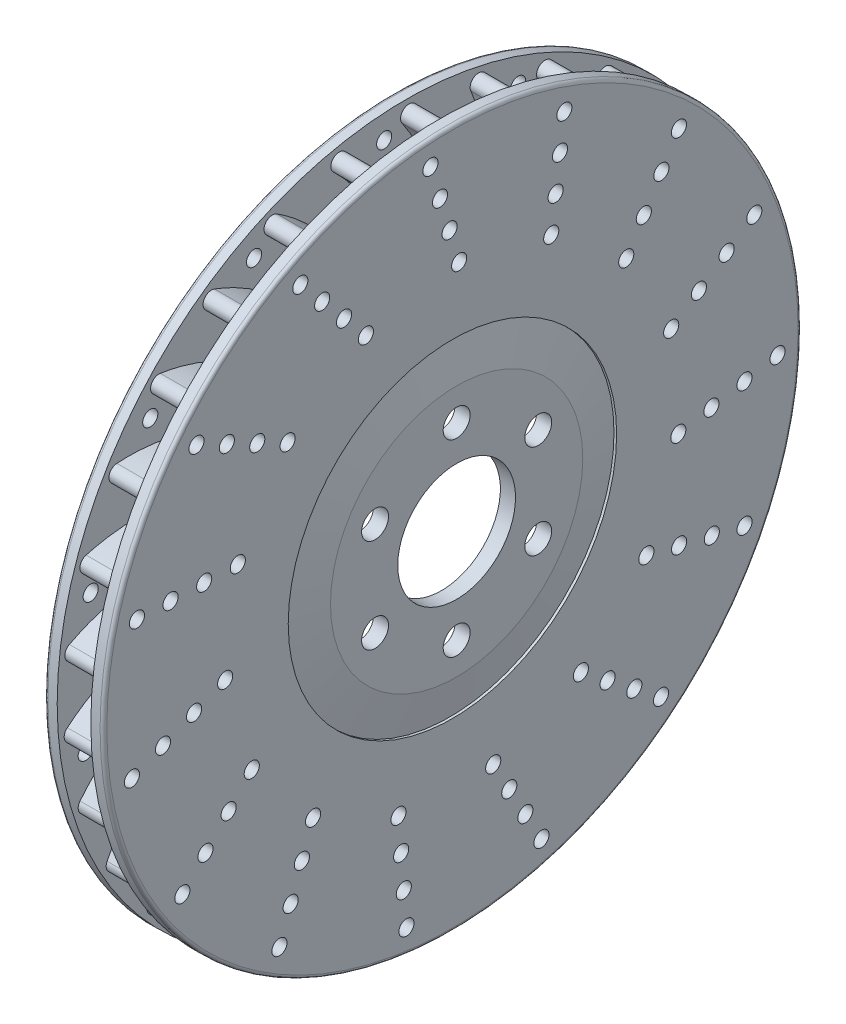
from build123d import *
from build123d.topology import SkipClean

# Parameters (mm, degrees)
SKETCH2_R                    = 8
CUT_EXTRUDE1_DEPTH           = 142.707445111
CIRPATTERN1_COUNT            = 6
SKETCH3_R                    = 207.5
SKETCH3_R_2                  = 125
BOSS_EXTRUDE1_DEPTH          = 7.5
BOSS_EXTRUDE2_DEPTH          = 20
SKETCH7_R                    = 207.5
BOSS_EXTRUDE3_DEPTH          = 7.5
CUT_EXTRUDE2_START           = -37.5
SKETCH6_R                    = 4.5
CUT_EXTRUDE2_DEPTH           = 89.5
LPATTERN1_COUNT              = 4
LPATTERN1_PITCH              = 20
CIRPATTERN5_COUNT            = 15
CIRPATTERN5_START            = -37.5
CIRPATTERN5_COPY_1_SKETCH_R  = 4.5
CIRPATTERN5_COPY_1_DEPTH     = 89.5
CIRPATTERN5_COPY_2_SKETCH_R  = 4.5
CIRPATTERN5_COPY_2_DEPTH     = 89.5
CIRPATTERN5_COPY_3_SKETCH_R  = 4.5
CIRPATTERN5_COPY_3_DEPTH     = 89.5
CIRPATTERN5_COPY_4_SKETCH_R  = 4.5
CIRPATTERN5_COPY_4_DEPTH     = 89.5
CIRPATTERN5_COPY_5_SKETCH_R  = 4.5
CIRPATTERN5_COPY_5_DEPTH     = 89.5
CIRPATTERN5_COPY_6_SKETCH_R  = 4.5
CIRPATTERN5_COPY_6_DEPTH     = 89.5
CIRPATTERN5_COPY_7_SKETCH_R  = 4.5
CIRPATTERN5_COPY_7_DEPTH     = 89.5
CIRPATTERN5_COPY_8_SKETCH_R  = 4.5
CIRPATTERN5_COPY_8_DEPTH     = 89.5
CIRPATTERN5_COPY_9_SKETCH_R  = 4.5
CIRPATTERN5_COPY_9_DEPTH     = 89.5
CIRPATTERN5_COPY_10_SKETCH_R = 4.5
CIRPATTERN5_COPY_10_DEPTH    = 89.5
CIRPATTERN5_COPY_11_SKETCH_R = 4.5
CIRPATTERN5_COPY_11_DEPTH    = 89.5
CIRPATTERN5_COPY_12_SKETCH_R = 4.5
CIRPATTERN5_COPY_12_DEPTH    = 89.5
CIRPATTERN5_COPY_13_SKETCH_R = 4.5
CIRPATTERN5_COPY_13_DEPTH    = 89.5
CIRPATTERN5_COPY_14_SKETCH_R = 4.5
CIRPATTERN5_COPY_14_DEPTH    = 89.5
CIRPATTERN5_COPY_15_SKETCH_R = 4.5
CIRPATTERN5_COPY_15_DEPTH    = 89.5
CIRPATTERN5_COPY_16_SKETCH_R = 4.5
CIRPATTERN5_COPY_16_DEPTH    = 89.5
CIRPATTERN5_COPY_17_SKETCH_R = 4.5
CIRPATTERN5_COPY_17_DEPTH    = 89.5
CIRPATTERN5_COPY_18_SKETCH_R = 4.5
CIRPATTERN5_COPY_18_DEPTH    = 89.5
CIRPATTERN5_COPY_19_SKETCH_R = 4.5
CIRPATTERN5_COPY_19_DEPTH    = 89.5
CIRPATTERN5_COPY_20_SKETCH_R = 4.5
CIRPATTERN5_COPY_20_DEPTH    = 89.5
CIRPATTERN5_COPY_21_SKETCH_R = 4.5
CIRPATTERN5_COPY_21_DEPTH    = 89.5
CIRPATTERN5_COPY_22_SKETCH_R = 4.5
CIRPATTERN5_COPY_22_DEPTH    = 89.5
CIRPATTERN5_COPY_23_SKETCH_R = 4.5
CIRPATTERN5_COPY_23_DEPTH    = 89.5
CIRPATTERN5_COPY_24_SKETCH_R = 4.5
CIRPATTERN5_COPY_24_DEPTH    = 89.5
CIRPATTERN5_COPY_25_SKETCH_R = 4.5
CIRPATTERN5_COPY_25_DEPTH    = 89.5
CIRPATTERN5_COPY_26_SKETCH_R = 4.5
CIRPATTERN5_COPY_26_DEPTH    = 89.5
CIRPATTERN5_COPY_27_SKETCH_R = 4.5
CIRPATTERN5_COPY_27_DEPTH    = 89.5
CIRPATTERN5_COPY_28_SKETCH_R = 4.5
CIRPATTERN5_COPY_28_DEPTH    = 89.5
CIRPATTERN5_COPY_29_SKETCH_R = 4.5
CIRPATTERN5_COPY_29_DEPTH    = 89.5
CIRPATTERN5_COPY_30_SKETCH_R = 4.5
CIRPATTERN5_COPY_30_DEPTH    = 89.5
CIRPATTERN5_COPY_31_SKETCH_R = 4.5
CIRPATTERN5_COPY_31_DEPTH    = 89.5
CIRPATTERN5_COPY_32_SKETCH_R = 4.5
CIRPATTERN5_COPY_32_DEPTH    = 89.5
CIRPATTERN5_COPY_33_SKETCH_R = 4.5
CIRPATTERN5_COPY_33_DEPTH    = 89.5
CIRPATTERN5_COPY_34_SKETCH_R = 4.5
CIRPATTERN5_COPY_34_DEPTH    = 89.5
CIRPATTERN5_COPY_35_SKETCH_R = 4.5
CIRPATTERN5_COPY_35_DEPTH    = 89.5
CIRPATTERN5_COPY_36_SKETCH_R = 4.5
CIRPATTERN5_COPY_36_DEPTH    = 89.5
CIRPATTERN5_COPY_37_SKETCH_R = 4.5
CIRPATTERN5_COPY_37_DEPTH    = 89.5
CIRPATTERN5_COPY_38_SKETCH_R = 4.5
CIRPATTERN5_COPY_38_DEPTH    = 89.5
CIRPATTERN5_COPY_39_SKETCH_R = 4.5
CIRPATTERN5_COPY_39_DEPTH    = 89.5
CIRPATTERN5_COPY_40_SKETCH_R = 4.5
CIRPATTERN5_COPY_40_DEPTH    = 89.5
CIRPATTERN5_COPY_41_SKETCH_R = 4.5
CIRPATTERN5_COPY_41_DEPTH    = 89.5
CIRPATTERN5_COPY_42_SKETCH_R = 4.5
CIRPATTERN5_COPY_42_DEPTH    = 89.5
CIRPATTERN14_COUNT           = 30
SKETCH8_R                    = 128.10445243
SKETCH8_R_2                  = 97.63605036
BOSS_EXTRUDE4_DEPTH          = 6.5
FILLET2_R                    = 2


with BuildPart() as part:
    # Sketch1 → Revolve1 (revolve)
    with BuildSketch(Plane.XY, mode=Mode.PRIVATE) as revolve1_sk:
        Polygon((0, 35), (9, 35), (9, 75), (4.5, 100), (0, 100), align=None)
    revolve(revolve1_sk.sketch.rotate(Axis((0, 0, 0), (1, 0, 0)), 90), axis=Axis((0, 0, 0), (1, 0, 0)))

    # Sketch2 → Cut-Extrude1 (cut, through all)
    with BuildSketch(Plane(origin=(9, 0, 0), x_dir=(0, 0, -1), z_dir=(1, 0, 0))):
        with Locations((0, 56)):
            Circle(SKETCH2_R)
    cut_extrude1 = extrude(amount=-CUT_EXTRUDE1_DEPTH, mode=Mode.SUBTRACT)

    # CirPattern1: Cut-Extrude1 ×6 about axis
    cirpattern1_axis = Axis((0, 0, 0), (1, 0, 0))
    for i in range(1, CIRPATTERN1_COUNT):
        add(cut_extrude1.rotate(cirpattern1_axis, i * 360 / CIRPATTERN1_COUNT), mode=Mode.SUBTRACT)



with BuildPart() as body_2:
    # Sketch3 → Boss-Extrude1 (new body)
    with BuildSketch(Plane.ZY.offset(1)):
        Circle(SKETCH3_R)
        Circle(SKETCH3_R_2, mode=Mode.SUBTRACT)
    extrude(amount=-BOSS_EXTRUDE1_DEPTH)

    # Sketch4 → Boss-Extrude2 (add)
    with BuildSketch(Plane(origin=(-1, 0, 0), x_dir=(0, 0, -1), z_dir=(1, 0, 0))):
        with BuildLine():
            add(Edge.make_bspline(
                [(124.253843947, 13.637531464), (162.995238886, 24.859986139), (181.365996199, 41.381375114), (193.886867661, 56.854803697)],
                knots=[0.423702293, 0.423702293, 0.423702293, 0.423702293, 1, 1, 1, 1], degree=3))
            ThreePointArc((193.886867661, 56.854803697), (193.061815238, 63.952883435), (185.982889152, 62.977048948))
            add(Edge.make_bspline(
                [(123.423286349, 19.791219941), (149.927075338, 29.87821764), (171.977980588, 44.079385153), (185.982889152, 62.977048948)],
                knots=[0.575554866, 0.575554866, 0.575554866, 0.575554866, 1, 1, 1, 1], degree=3))
            ThreePointArc((123.423286349, 19.791219941), (123.876782281, 16.719533833), (124.253843947, 13.637531464))
        make_face()
    boss_extrude2 = extrude(amount=-BOSS_EXTRUDE2_DEPTH)

    # Sketch7 → Boss-Extrude3 (add)
    with BuildSketch(Plane.ZY.offset(21)):
        Circle(SKETCH7_R)
        with BuildLine():
            ThreePointArc((-124.253843947, 13.637531464), (123.876782281, -16.719533833), (-123.423286349, 19.791219941))
            ThreePointArc((-123.423286349, 19.791219941), (-123.876782281, 16.719533833), (-124.253843947, 13.637531464))
        make_face(mode=Mode.SUBTRACT)
    extrude(amount=BOSS_EXTRUDE3_DEPTH)

    # Sketch6 → Cut-Extrude2 (cut)
    with BuildSketch(Plane.ZY.offset(11).offset(CUT_EXTRUDE2_START)):
        with Locations(Location((-4, 135.461442201, 0), (0, 0, 180))):
            Circle(SKETCH6_R)
    cut_extrude2 = extrude(amount=CUT_EXTRUDE2_DEPTH, mode=Mode.SUBTRACT)

    # LPattern1: Cut-Extrude2 ×4
    with Locations(*[Vector(0, 0.9586177058834077, 0.2846964944758412) * (i * LPATTERN1_PITCH) for i in range(1, LPATTERN1_COUNT)]):
        add(cut_extrude2, mode=Mode.SUBTRACT)

    # CirPattern5: Cut-Extrude2 ×15 about axis
    cirpattern5_axis = Axis((0, 0, 0), (1, 0, 0))
    for i in range(1, CIRPATTERN5_COUNT):
        add(cut_extrude2.rotate(cirpattern5_axis, i * 360 / CIRPATTERN5_COUNT), mode=Mode.SUBTRACT)

    # CirPattern5 copy 1 sketch → CirPattern5 copy 1 (cut)
    with BuildSketch(Plane(origin=(-11, 15.198887087, 12.99976274), x_dir=(0, -0.4067366430758002, 0.9135454576426009), z_dir=(-1, 0, 0)).offset(CIRPATTERN5_START)):
        with Locations(Location((-4, 135.461442201, 0), (0, 0, 180))):
            Circle(CIRPATTERN5_COPY_1_SKETCH_R)
    extrude(amount=CIRPATTERN5_COPY_1_DEPTH, mode=Mode.SUBTRACT)

    # CirPattern5 copy 2 sketch → CirPattern5 copy 2 (cut)
    with BuildSketch(Plane(origin=(-11, 8.597394402, 18.057818514), x_dir=(0, -0.7431448254773942, 0.6691306063588582), z_dir=(-1, 0, 0)).offset(CIRPATTERN5_START)):
        with Locations(Location((-4, 135.461442201, 0), (0, 0, 180))):
            Circle(CIRPATTERN5_COPY_2_SKETCH_R)
    extrude(amount=CIRPATTERN5_COPY_2_DEPTH, mode=Mode.SUBTRACT)

    # CirPattern5 copy 3 sketch → CirPattern5 copy 3 (cut)
    with BuildSketch(Plane(origin=(-11, 0.50933412, 19.993513417), x_dir=(0, -0.9510565162951535, 0.30901699437494745), z_dir=(-1, 0, 0)).offset(CIRPATTERN5_START)):
        with Locations(Location((-4, 135.461442201, 0), (0, 0, 180))):
            Circle(CIRPATTERN5_COPY_3_SKETCH_R)
    extrude(amount=CIRPATTERN5_COPY_3_DEPTH, mode=Mode.SUBTRACT)

    # CirPattern5 copy 4 sketch → CirPattern5 copy 4 (cut)
    with BuildSketch(Plane(origin=(-11, -7.666794659, 18.472148214), x_dir=(0, -0.9945218953682733, -0.10452846326765355), z_dir=(-1, 0, 0)).offset(CIRPATTERN5_START)):
        with Locations(Location((-4, 135.461442201, 0), (0, 0, 180))):
            Circle(CIRPATTERN5_COPY_4_SKETCH_R)
    extrude(amount=CIRPATTERN5_COPY_4_DEPTH, mode=Mode.SUBTRACT)

    # CirPattern5 copy 5 sketch → CirPattern5 copy 5 (cut)
    with BuildSketch(Plane(origin=(-11, -14.517264991, 13.756780771), x_dir=(0, -0.8660254037844387, -0.4999999999999998), z_dir=(-1, 0, 0)).offset(CIRPATTERN5_START)):
        with Locations(Location((-4, 135.461442201, 0), (0, 0, 180))):
            Circle(CIRPATTERN5_COPY_5_SKETCH_R)
    extrude(amount=CIRPATTERN5_COPY_5_DEPTH, mode=Mode.SUBTRACT)

    # CirPattern5 copy 6 sketch → CirPattern5 copy 6 (cut)
    with BuildSketch(Plane(origin=(-11, -18.85756832, 6.662740957), x_dir=(0, -0.5877852522924732, -0.8090169943749473), z_dir=(-1, 0, 0)).offset(CIRPATTERN5_START)):
        with Locations(Location((-4, 135.461442201, 0), (0, 0, 180))):
            Circle(CIRPATTERN5_COPY_6_SKETCH_R)
    extrude(amount=CIRPATTERN5_COPY_6_DEPTH, mode=Mode.SUBTRACT)

    # CirPattern5 copy 7 sketch → CirPattern5 copy 7 (cut)
    with BuildSketch(Plane(origin=(-11, -19.937226771, -1.583347299), x_dir=(0, -0.20791169081775931, -0.9781476007338057), z_dir=(-1, 0, 0)).offset(CIRPATTERN5_START)):
        with Locations(Location((-4, 135.461442201, 0), (0, 0, 180))):
            Circle(CIRPATTERN5_COPY_7_SKETCH_R)
    extrude(amount=CIRPATTERN5_COPY_7_DEPTH, mode=Mode.SUBTRACT)

    # CirPattern5 copy 8 sketch → CirPattern5 copy 8 (cut)
    with BuildSketch(Plane(origin=(-11, -17.56955759, -9.555660422), x_dir=(0, 0.2079116908177595, -0.9781476007338056), z_dir=(-1, 0, 0)).offset(CIRPATTERN5_START)):
        with Locations(Location((-4, 135.461442201, 0), (0, 0, 180))):
            Circle(CIRPATTERN5_COPY_8_SKETCH_R)
    extrude(amount=CIRPATTERN5_COPY_8_DEPTH, mode=Mode.SUBTRACT)

    # CirPattern5 copy 9 sketch → CirPattern5 copy 9 (cut)
    with BuildSketch(Plane(origin=(-11, -12.163952287, -15.875713047), x_dir=(0, 0.587785252292473, -0.8090169943749476), z_dir=(-1, 0, 0)).offset(CIRPATTERN5_START)):
        with Locations(Location((-4, 135.461442201, 0), (0, 0, 180))):
            Circle(CIRPATTERN5_COPY_9_SKETCH_R)
    extrude(amount=CIRPATTERN5_COPY_9_DEPTH, mode=Mode.SUBTRACT)

    # CirPattern5 copy 10 sketch → CirPattern5 copy 10 (cut)
    with BuildSketch(Plane(origin=(-11, -4.655089127, -19.450710661), x_dir=(0, 0.8660254037844384, -0.5000000000000004), z_dir=(-1, 0, 0)).offset(CIRPATTERN5_START)):
        with Locations(Location((-4, 135.461442201, 0), (0, 0, 180))):
            Circle(CIRPATTERN5_COPY_10_SKETCH_R)
    extrude(amount=CIRPATTERN5_COPY_10_DEPTH, mode=Mode.SUBTRACT)

    # CirPattern5 copy 11 sketch → CirPattern5 copy 11 (cut)
    with BuildSketch(Plane(origin=(-11, 3.658681233, -19.662503697), x_dir=(0, 0.9945218953682734, -0.10452846326765336), z_dir=(-1, 0, 0)).offset(CIRPATTERN5_START)):
        with Locations(Location((-4, 135.461442201, 0), (0, 0, 180))):
            Circle(CIRPATTERN5_COPY_11_SKETCH_R)
    extrude(amount=CIRPATTERN5_COPY_11_DEPTH, mode=Mode.SUBTRACT)

    # CirPattern5 copy 12 sketch → CirPattern5 copy 12 (cut)
    with BuildSketch(Plane(origin=(-11, 11.339832369, -16.474471216), x_dir=(0, 0.9510565162951536, 0.30901699437494723), z_dir=(-1, 0, 0)).offset(CIRPATTERN5_START)):
        with Locations(Location((-4, 135.461442201, 0), (0, 0, 180))):
            Circle(CIRPATTERN5_COPY_12_SKETCH_R)
    extrude(amount=CIRPATTERN5_COPY_12_DEPTH, mode=Mode.SUBTRACT)

    # CirPattern5 copy 13 sketch → CirPattern5 copy 13 (cut)
    with BuildSketch(Plane(origin=(-11, 17.06022347, -10.437852995), x_dir=(0, 0.7431448254773946, 0.6691306063588578), z_dir=(-1, 0, 0)).offset(CIRPATTERN5_START)):
        with Locations(Location((-4, 135.461442201, 0), (0, 0, 180))):
            Circle(CIRPATTERN5_COPY_13_SKETCH_R)
    extrude(amount=CIRPATTERN5_COPY_13_DEPTH, mode=Mode.SUBTRACT)

    # CirPattern5 copy 14 sketch → CirPattern5 copy 14 (cut)
    with BuildSketch(Plane(origin=(-11, 19.830746946, -2.596435167), x_dir=(0, 0.40673664307580015, 0.913545457642601), z_dir=(-1, 0, 0)).offset(CIRPATTERN5_START)):
        with Locations(Location((-4, 135.461442201, 0), (0, 0, 180))):
            Circle(CIRPATTERN5_COPY_14_SKETCH_R)
    extrude(amount=CIRPATTERN5_COPY_14_DEPTH, mode=Mode.SUBTRACT)

    # CirPattern5 copy 15 sketch → CirPattern5 copy 15 (cut)
    with BuildSketch(Plane(origin=(-11, 30.397774175, 25.999525481), x_dir=(0, -0.4067366430758002, 0.9135454576426009), z_dir=(-1, 0, 0)).offset(CIRPATTERN5_START)):
        with Locations(Location((-4, 135.461442201, 0), (0, 0, 180))):
            Circle(CIRPATTERN5_COPY_15_SKETCH_R)
    extrude(amount=CIRPATTERN5_COPY_15_DEPTH, mode=Mode.SUBTRACT)

    # CirPattern5 copy 16 sketch → CirPattern5 copy 16 (cut)
    with BuildSketch(Plane(origin=(-11, 17.194788804, 36.115637029), x_dir=(0, -0.7431448254773942, 0.6691306063588582), z_dir=(-1, 0, 0)).offset(CIRPATTERN5_START)):
        with Locations(Location((-4, 135.461442201, 0), (0, 0, 180))):
            Circle(CIRPATTERN5_COPY_16_SKETCH_R)
    extrude(amount=CIRPATTERN5_COPY_16_DEPTH, mode=Mode.SUBTRACT)

    # CirPattern5 copy 17 sketch → CirPattern5 copy 17 (cut)
    with BuildSketch(Plane(origin=(-11, 1.01866824, 39.987026834), x_dir=(0, -0.9510565162951535, 0.30901699437494745), z_dir=(-1, 0, 0)).offset(CIRPATTERN5_START)):
        with Locations(Location((-4, 135.461442201, 0), (0, 0, 180))):
            Circle(CIRPATTERN5_COPY_17_SKETCH_R)
    extrude(amount=CIRPATTERN5_COPY_17_DEPTH, mode=Mode.SUBTRACT)

    # CirPattern5 copy 18 sketch → CirPattern5 copy 18 (cut)
    with BuildSketch(Plane(origin=(-11, -15.333589318, 36.944296429), x_dir=(0, -0.9945218953682733, -0.10452846326765355), z_dir=(-1, 0, 0)).offset(CIRPATTERN5_START)):
        with Locations(Location((-4, 135.461442201, 0), (0, 0, 180))):
            Circle(CIRPATTERN5_COPY_18_SKETCH_R)
    extrude(amount=CIRPATTERN5_COPY_18_DEPTH, mode=Mode.SUBTRACT)

    # CirPattern5 copy 19 sketch → CirPattern5 copy 19 (cut)
    with BuildSketch(Plane(origin=(-11, -29.034529981, 27.513561543), x_dir=(0, -0.8660254037844387, -0.4999999999999998), z_dir=(-1, 0, 0)).offset(CIRPATTERN5_START)):
        with Locations(Location((-4, 135.461442201, 0), (0, 0, 180))):
            Circle(CIRPATTERN5_COPY_19_SKETCH_R)
    extrude(amount=CIRPATTERN5_COPY_19_DEPTH, mode=Mode.SUBTRACT)

    # CirPattern5 copy 20 sketch → CirPattern5 copy 20 (cut)
    with BuildSketch(Plane(origin=(-11, -37.71513664, 13.325481913), x_dir=(0, -0.5877852522924732, -0.8090169943749473), z_dir=(-1, 0, 0)).offset(CIRPATTERN5_START)):
        with Locations(Location((-4, 135.461442201, 0), (0, 0, 180))):
            Circle(CIRPATTERN5_COPY_20_SKETCH_R)
    extrude(amount=CIRPATTERN5_COPY_20_DEPTH, mode=Mode.SUBTRACT)

    # CirPattern5 copy 21 sketch → CirPattern5 copy 21 (cut)
    with BuildSketch(Plane(origin=(-11, -39.874453543, -3.166694597), x_dir=(0, -0.20791169081775931, -0.9781476007338057), z_dir=(-1, 0, 0)).offset(CIRPATTERN5_START)):
        with Locations(Location((-4, 135.461442201, 0), (0, 0, 180))):
            Circle(CIRPATTERN5_COPY_21_SKETCH_R)
    extrude(amount=CIRPATTERN5_COPY_21_DEPTH, mode=Mode.SUBTRACT)

    # CirPattern5 copy 22 sketch → CirPattern5 copy 22 (cut)
    with BuildSketch(Plane(origin=(-11, -35.13911518, -19.111320843), x_dir=(0, 0.2079116908177595, -0.9781476007338056), z_dir=(-1, 0, 0)).offset(CIRPATTERN5_START)):
        with Locations(Location((-4, 135.461442201, 0), (0, 0, 180))):
            Circle(CIRPATTERN5_COPY_22_SKETCH_R)
    extrude(amount=CIRPATTERN5_COPY_22_DEPTH, mode=Mode.SUBTRACT)

    # CirPattern5 copy 23 sketch → CirPattern5 copy 23 (cut)
    with BuildSketch(Plane(origin=(-11, -24.327904573, -31.751426095), x_dir=(0, 0.587785252292473, -0.8090169943749476), z_dir=(-1, 0, 0)).offset(CIRPATTERN5_START)):
        with Locations(Location((-4, 135.461442201, 0), (0, 0, 180))):
            Circle(CIRPATTERN5_COPY_23_SKETCH_R)
    extrude(amount=CIRPATTERN5_COPY_23_DEPTH, mode=Mode.SUBTRACT)

    # CirPattern5 copy 24 sketch → CirPattern5 copy 24 (cut)
    with BuildSketch(Plane(origin=(-11, -9.310178254, -38.901421322), x_dir=(0, 0.8660254037844384, -0.5000000000000004), z_dir=(-1, 0, 0)).offset(CIRPATTERN5_START)):
        with Locations(Location((-4, 135.461442201, 0), (0, 0, 180))):
            Circle(CIRPATTERN5_COPY_24_SKETCH_R)
    extrude(amount=CIRPATTERN5_COPY_24_DEPTH, mode=Mode.SUBTRACT)

    # CirPattern5 copy 25 sketch → CirPattern5 copy 25 (cut)
    with BuildSketch(Plane(origin=(-11, 7.317362465, -39.325007394), x_dir=(0, 0.9945218953682734, -0.10452846326765336), z_dir=(-1, 0, 0)).offset(CIRPATTERN5_START)):
        with Locations(Location((-4, 135.461442201, 0), (0, 0, 180))):
            Circle(CIRPATTERN5_COPY_25_SKETCH_R)
    extrude(amount=CIRPATTERN5_COPY_25_DEPTH, mode=Mode.SUBTRACT)

    # CirPattern5 copy 26 sketch → CirPattern5 copy 26 (cut)
    with BuildSketch(Plane(origin=(-11, 22.679664739, -32.948942431), x_dir=(0, 0.9510565162951536, 0.30901699437494723), z_dir=(-1, 0, 0)).offset(CIRPATTERN5_START)):
        with Locations(Location((-4, 135.461442201, 0), (0, 0, 180))):
            Circle(CIRPATTERN5_COPY_26_SKETCH_R)
    extrude(amount=CIRPATTERN5_COPY_26_DEPTH, mode=Mode.SUBTRACT)

    # CirPattern5 copy 27 sketch → CirPattern5 copy 27 (cut)
    with BuildSketch(Plane(origin=(-11, 34.12044694, -20.87570599), x_dir=(0, 0.7431448254773946, 0.6691306063588578), z_dir=(-1, 0, 0)).offset(CIRPATTERN5_START)):
        with Locations(Location((-4, 135.461442201, 0), (0, 0, 180))):
            Circle(CIRPATTERN5_COPY_27_SKETCH_R)
    extrude(amount=CIRPATTERN5_COPY_27_DEPTH, mode=Mode.SUBTRACT)

    # CirPattern5 copy 28 sketch → CirPattern5 copy 28 (cut)
    with BuildSketch(Plane(origin=(-11, 39.661493891, -5.192870334), x_dir=(0, 0.40673664307580015, 0.913545457642601), z_dir=(-1, 0, 0)).offset(CIRPATTERN5_START)):
        with Locations(Location((-4, 135.461442201, 0), (0, 0, 180))):
            Circle(CIRPATTERN5_COPY_28_SKETCH_R)
    extrude(amount=CIRPATTERN5_COPY_28_DEPTH, mode=Mode.SUBTRACT)

    # CirPattern5 copy 29 sketch → CirPattern5 copy 29 (cut)
    with BuildSketch(Plane(origin=(-11, 45.596661262, 38.999288221), x_dir=(0, -0.4067366430758002, 0.9135454576426009), z_dir=(-1, 0, 0)).offset(CIRPATTERN5_START)):
        with Locations(Location((-4, 135.461442201, 0), (0, 0, 180))):
            Circle(CIRPATTERN5_COPY_29_SKETCH_R)
    extrude(amount=CIRPATTERN5_COPY_29_DEPTH, mode=Mode.SUBTRACT)

    # CirPattern5 copy 30 sketch → CirPattern5 copy 30 (cut)
    with BuildSketch(Plane(origin=(-11, 25.792183206, 54.173455543), x_dir=(0, -0.7431448254773942, 0.6691306063588582), z_dir=(-1, 0, 0)).offset(CIRPATTERN5_START)):
        with Locations(Location((-4, 135.461442201, 0), (0, 0, 180))):
            Circle(CIRPATTERN5_COPY_30_SKETCH_R)
    extrude(amount=CIRPATTERN5_COPY_30_DEPTH, mode=Mode.SUBTRACT)

    # CirPattern5 copy 31 sketch → CirPattern5 copy 31 (cut)
    with BuildSketch(Plane(origin=(-11, 1.528002359, 59.980540251), x_dir=(0, -0.9510565162951535, 0.30901699437494745), z_dir=(-1, 0, 0)).offset(CIRPATTERN5_START)):
        with Locations(Location((-4, 135.461442201, 0), (0, 0, 180))):
            Circle(CIRPATTERN5_COPY_31_SKETCH_R)
    extrude(amount=CIRPATTERN5_COPY_31_DEPTH, mode=Mode.SUBTRACT)

    # CirPattern5 copy 32 sketch → CirPattern5 copy 32 (cut)
    with BuildSketch(Plane(origin=(-11, -23.000383977, 55.416444643), x_dir=(0, -0.9945218953682733, -0.10452846326765355), z_dir=(-1, 0, 0)).offset(CIRPATTERN5_START)):
        with Locations(Location((-4, 135.461442201, 0), (0, 0, 180))):
            Circle(CIRPATTERN5_COPY_32_SKETCH_R)
    extrude(amount=CIRPATTERN5_COPY_32_DEPTH, mode=Mode.SUBTRACT)

    # CirPattern5 copy 33 sketch → CirPattern5 copy 33 (cut)
    with BuildSketch(Plane(origin=(-11, -43.551794972, 41.270342314), x_dir=(0, -0.8660254037844387, -0.4999999999999998), z_dir=(-1, 0, 0)).offset(CIRPATTERN5_START)):
        with Locations(Location((-4, 135.461442201, 0), (0, 0, 180))):
            Circle(CIRPATTERN5_COPY_33_SKETCH_R)
    extrude(amount=CIRPATTERN5_COPY_33_DEPTH, mode=Mode.SUBTRACT)

    # CirPattern5 copy 34 sketch → CirPattern5 copy 34 (cut)
    with BuildSketch(Plane(origin=(-11, -56.57270496, 19.98822287), x_dir=(0, -0.5877852522924732, -0.8090169943749473), z_dir=(-1, 0, 0)).offset(CIRPATTERN5_START)):
        with Locations(Location((-4, 135.461442201, 0), (0, 0, 180))):
            Circle(CIRPATTERN5_COPY_34_SKETCH_R)
    extrude(amount=CIRPATTERN5_COPY_34_DEPTH, mode=Mode.SUBTRACT)

    # CirPattern5 copy 35 sketch → CirPattern5 copy 35 (cut)
    with BuildSketch(Plane(origin=(-11, -59.811680314, -4.750041896), x_dir=(0, -0.20791169081775931, -0.9781476007338057), z_dir=(-1, 0, 0)).offset(CIRPATTERN5_START)):
        with Locations(Location((-4, 135.461442201, 0), (0, 0, 180))):
            Circle(CIRPATTERN5_COPY_35_SKETCH_R)
    extrude(amount=CIRPATTERN5_COPY_35_DEPTH, mode=Mode.SUBTRACT)

    # CirPattern5 copy 36 sketch → CirPattern5 copy 36 (cut)
    with BuildSketch(Plane(origin=(-11, -52.70867277, -28.666981265), x_dir=(0, 0.2079116908177595, -0.9781476007338056), z_dir=(-1, 0, 0)).offset(CIRPATTERN5_START)):
        with Locations(Location((-4, 135.461442201, 0), (0, 0, 180))):
            Circle(CIRPATTERN5_COPY_36_SKETCH_R)
    extrude(amount=CIRPATTERN5_COPY_36_DEPTH, mode=Mode.SUBTRACT)

    # CirPattern5 copy 37 sketch → CirPattern5 copy 37 (cut)
    with BuildSketch(Plane(origin=(-11, -36.49185686, -47.627139142), x_dir=(0, 0.587785252292473, -0.8090169943749476), z_dir=(-1, 0, 0)).offset(CIRPATTERN5_START)):
        with Locations(Location((-4, 135.461442201, 0), (0, 0, 180))):
            Circle(CIRPATTERN5_COPY_37_SKETCH_R)
    extrude(amount=CIRPATTERN5_COPY_37_DEPTH, mode=Mode.SUBTRACT)

    # CirPattern5 copy 38 sketch → CirPattern5 copy 38 (cut)
    with BuildSketch(Plane(origin=(-11, -13.965267381, -58.352131983), x_dir=(0, 0.8660254037844384, -0.5000000000000004), z_dir=(-1, 0, 0)).offset(CIRPATTERN5_START)):
        with Locations(Location((-4, 135.461442201, 0), (0, 0, 180))):
            Circle(CIRPATTERN5_COPY_38_SKETCH_R)
    extrude(amount=CIRPATTERN5_COPY_38_DEPTH, mode=Mode.SUBTRACT)

    # CirPattern5 copy 39 sketch → CirPattern5 copy 39 (cut)
    with BuildSketch(Plane(origin=(-11, 10.976043698, -58.987511091), x_dir=(0, 0.9945218953682734, -0.10452846326765336), z_dir=(-1, 0, 0)).offset(CIRPATTERN5_START)):
        with Locations(Location((-4, 135.461442201, 0), (0, 0, 180))):
            Circle(CIRPATTERN5_COPY_39_SKETCH_R)
    extrude(amount=CIRPATTERN5_COPY_39_DEPTH, mode=Mode.SUBTRACT)

    # CirPattern5 copy 40 sketch → CirPattern5 copy 40 (cut)
    with BuildSketch(Plane(origin=(-11, 34.019497108, -49.423413647), x_dir=(0, 0.9510565162951536, 0.30901699437494723), z_dir=(-1, 0, 0)).offset(CIRPATTERN5_START)):
        with Locations(Location((-4, 135.461442201, 0), (0, 0, 180))):
            Circle(CIRPATTERN5_COPY_40_SKETCH_R)
    extrude(amount=CIRPATTERN5_COPY_40_DEPTH, mode=Mode.SUBTRACT)

    # CirPattern5 copy 41 sketch → CirPattern5 copy 41 (cut)
    with BuildSketch(Plane(origin=(-11, 51.18067041, -31.313558986), x_dir=(0, 0.7431448254773946, 0.6691306063588578), z_dir=(-1, 0, 0)).offset(CIRPATTERN5_START)):
        with Locations(Location((-4, 135.461442201, 0), (0, 0, 180))):
            Circle(CIRPATTERN5_COPY_41_SKETCH_R)
    extrude(amount=CIRPATTERN5_COPY_41_DEPTH, mode=Mode.SUBTRACT)

    # CirPattern5 copy 42 sketch → CirPattern5 copy 42 (cut)
    with BuildSketch(Plane(origin=(-11, 59.492240837, -7.789305501), x_dir=(0, 0.40673664307580015, 0.913545457642601), z_dir=(-1, 0, 0)).offset(CIRPATTERN5_START)):
        with Locations(Location((-4, 135.461442201, 0), (0, 0, 180))):
            Circle(CIRPATTERN5_COPY_42_SKETCH_R)
    extrude(amount=CIRPATTERN5_COPY_42_DEPTH, mode=Mode.SUBTRACT)

    # CirPattern14: Boss-Extrude2 ×30 about axis
    with SkipClean():  # the faces are left unmerged after this step: merging them gives an invalid solid
        cirpattern14_axis = Axis((-28.5, 0, 0), (-1, 0, 0))
        for i in range(1, CIRPATTERN14_COUNT):
            add(boss_extrude2.rotate(cirpattern14_axis, i * 360 / CIRPATTERN14_COUNT))


with BuildPart() as part_1:
    with SkipClean():  # the faces are left unmerged after this step: merging them gives an invalid solid
        add(part.part)

        add(body_2.part)  # Boss-Extrude4 merges body 2
        # Sketch8 → Boss-Extrude4 (add)
        with BuildSketch(Plane(origin=(6.5, 0, 0), x_dir=(0, 0, -1), z_dir=(1, 0, 0))):
            Circle(SKETCH8_R)
            Circle(SKETCH8_R_2, mode=Mode.SUBTRACT)
        extrude(amount=-BOSS_EXTRUDE4_DEPTH)

    # Fillet2
    fillet2_edges = [part_1.edges().sort_by_distance(p)[0] for p in [
        (6.5, 0, -207.5),
        (-28.5, 0, -207.5),
    ]]
    fillet(fillet2_edges, radius=FILLET2_R)


solid = part_1.part
